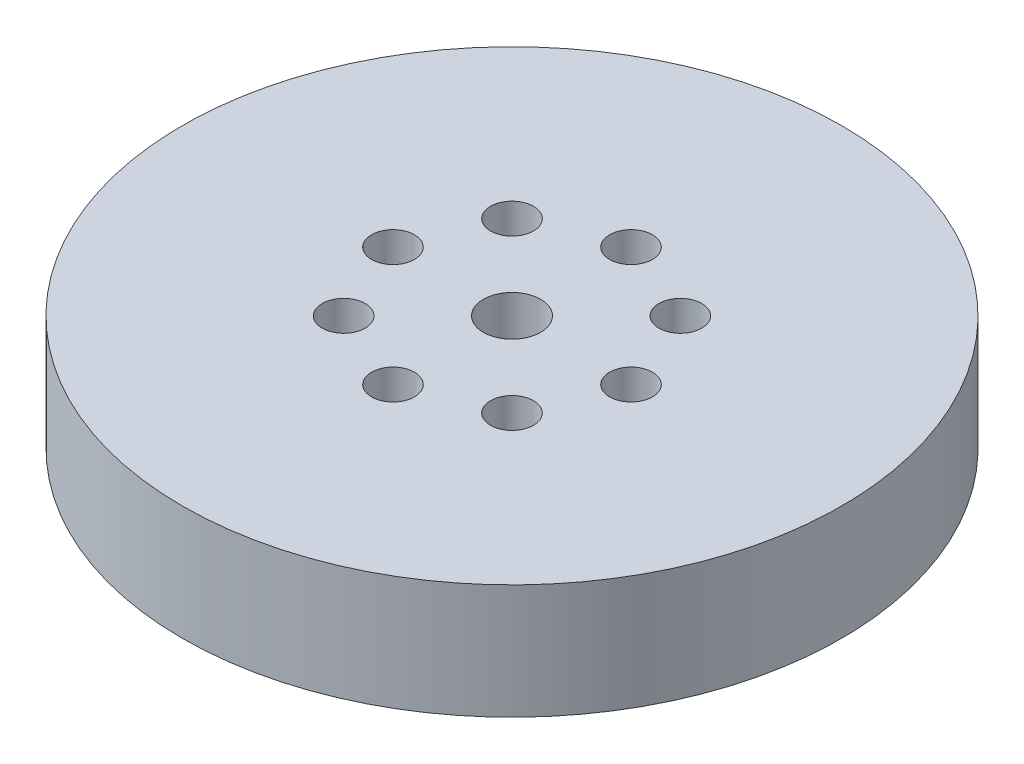
from build123d import *

# Parameters (mm, degrees)
SKETCH1_R           = 57.5
BOSS_EXTRUDE1_DEPTH = 20
SKETCH2_R           = 5
CUT_EXTRUDE1_DEPTH  = 84.740671122
SKETCH3_R           = 3.739713108
CUT_EXTRUDE2_DEPTH  = 19.078201634
CIRPATTERN1_COUNT   = 8


with BuildPart() as part:
    # Sketch1 → Boss-Extrude1 (new body)
    with BuildSketch(Plane(origin=(0, 0, 0), x_dir=(1, 0, 0), z_dir=(0, 1, 0))):
        Circle(SKETCH1_R)
    extrude(amount=BOSS_EXTRUDE1_DEPTH)

    # Sketch2 → Cut-Extrude1 (cut, through all)
    with BuildSketch(Plane(origin=(0, 0, 0), x_dir=(1, 0, 0), z_dir=(0, 1, 0))):
        Circle(SKETCH2_R)
    extrude(amount=CUT_EXTRUDE1_DEPTH, mode=Mode.SUBTRACT)

    # Sketch3 → Cut-Extrude2 (cut)
    with BuildSketch(Plane(origin=(0, 20, 0), x_dir=(1, 0, 0), z_dir=(0, 1, 0))):
        with Locations((-20.76525971, 0)):
            Circle(SKETCH3_R)
    cut_extrude2 = extrude(amount=-CUT_EXTRUDE2_DEPTH, mode=Mode.SUBTRACT)

    # CirPattern1: Cut-Extrude2 ×8 about axis
    cirpattern1_axis = Axis((0, 0, 0), (0, 1, 0))
    for i in range(1, CIRPATTERN1_COUNT):
        add(cut_extrude2.rotate(cirpattern1_axis, i * 360 / CIRPATTERN1_COUNT), mode=Mode.SUBTRACT)


solid = part.part
